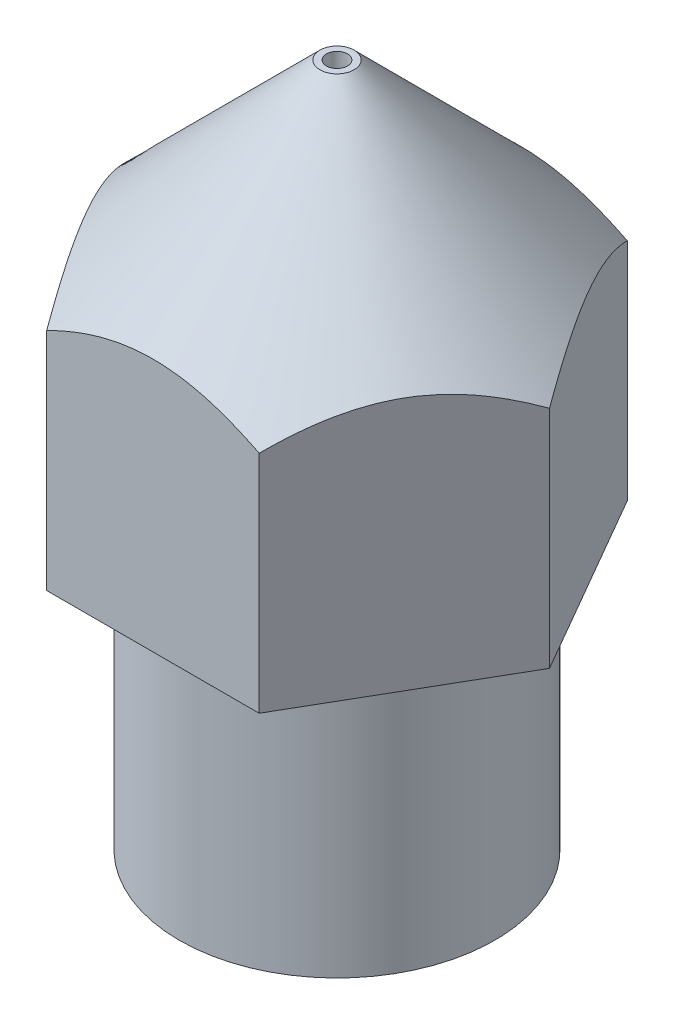
from build123d import *

# Parameters (mm, degrees)
EXTRUDE_1_DEPTH     = 8000
SKETCH_3_R          = 200
CUT_EXTRUDE_1_DEPTH = 8000
SKETCH_4_R          = 1190
CUT_EXTRUDE_2_DEPTH = 6000
CHAMFER_3_SIZE      = 1000
EXTRUDE_START       = 5000
SKETCH_5_R          = 3000
SKETCH_5_R_2        = 1190
EXTRUDE_2_DEPTH     = 5000
CUT_EXTRUDE_3_DEPTH = 100


with BuildPart() as part:
    # 草圖1 → 填料-伸長1 (new body)
    with BuildSketch(Plane(origin=(0, 0, 0), x_dir=(1, 0, 0), z_dir=(0, 1, 0))):
        Polygon((2020.725942164, -3500), (4041.451884327, 0), (2020.725942164, 3500), (-2020.725942164, 3500), (-4041.451884327, 0), (-2020.725942164, -3500), align=None)
    extrude(amount=EXTRUDE_1_DEPTH)

    # 草圖2 → 除料-旋轉1 (revolve, cut)
    with BuildSketch(Plane.XY, mode=Mode.PRIVATE) as cut_revolve_1_sk:
        Polygon((325, 8000), (5325, 3000), (5325, 8000), align=None)
    revolve(cut_revolve_1_sk.sketch.rotate(Axis((0, 8167.684027577, 0), (0, -1, 0)), 300), axis=Axis((0, 8167.684027577, 0), (0, -1, 0)), mode=Mode.SUBTRACT)

    # 草圖3 → 除料-伸長1 (cut)
    with BuildSketch(Plane(origin=(0, 8000, 0), x_dir=(1, 0, 0), z_dir=(0, 1, 0))):
        with Locations(Location((0, 0, 0), (0, 0, 270))):
            Circle(SKETCH_3_R)
    extrude(amount=-CUT_EXTRUDE_1_DEPTH, mode=Mode.SUBTRACT)

    # 草圖4 → 除料-伸長2 (cut)
    with BuildSketch(Plane.XZ):
        with Locations(Location((0, 0, 0), (0, 0, 270))):
            Circle(SKETCH_4_R)
    extrude(amount=-CUT_EXTRUDE_2_DEPTH, mode=Mode.SUBTRACT)

    # 導角3
    # the kernel refuses this chamfer: 1000 mm, written as the material it takes off along each edge
    with BuildSketch(Plane(origin=(0, 6000, 0), x_dir=(0, 0, 1), z_dir=(-1, 0, 0))) as chamfer_3_piece_1_section:
        Polygon((200 + CHAMFER_3_SIZE, 0), (200, CHAMFER_3_SIZE), (200, 0), align=None)
    chamfer_3_piece_1 = revolve(axis=Axis((0, 6000, 0), (0, 1, 0)), mode=Mode.PRIVATE)
    chamfer_3_piece_1 = chamfer_3_piece_1 & Plane(origin=(0, 6510.507798726, 0), x_dir=(0, 0, -1), z_dir=(0, -1, 0)) * Cylinder(1190, 4800, mode=Mode.PRIVATE)
    add(chamfer_3_piece_1, mode=Mode.SUBTRACT)

    # 草圖5 → 填料-伸長2 (add)
    with BuildSketch(Plane.XZ.offset(EXTRUDE_START)):
        with Locations(Location((0, 0, 0), (0, 0, 90))):
            Circle(SKETCH_5_R)
        with Locations(Location((0, 0, 0), (0, 0, 270))):
            Circle(SKETCH_5_R_2, mode=Mode.SUBTRACT)
    extrude(amount=-EXTRUDE_2_DEPTH)

    # 草圖6 → 除料-伸長3 (cut)
    with BuildSketch(Plane(origin=(0, 0, -3500), x_dir=(-1, 0, 0), z_dir=(0, 0, -1))):
        Polygon((800.213579713, 4245.147560037), (854.901079713, 4245.147560037), (854.901079713, 2168.224483114), (1201.054925867, 2168.224483114), (1201.054925867, 1860.532175422), (854.901079713, 1860.532175422), (854.901079713, 1168.224483114), (585.670310482, 1168.224483114), (585.670310482, 1860.532175422), (-837.406612595, 1860.532175422), align=None)
        Polygon((585.670310482, 2168.224483114), (585.670310482, 3471.109098499), (-308.560458749, 2168.224483114), align=None, mode=Mode.SUBTRACT)
    extrude(amount=-CUT_EXTRUDE_3_DEPTH, mode=Mode.SUBTRACT)


solid = part.part
